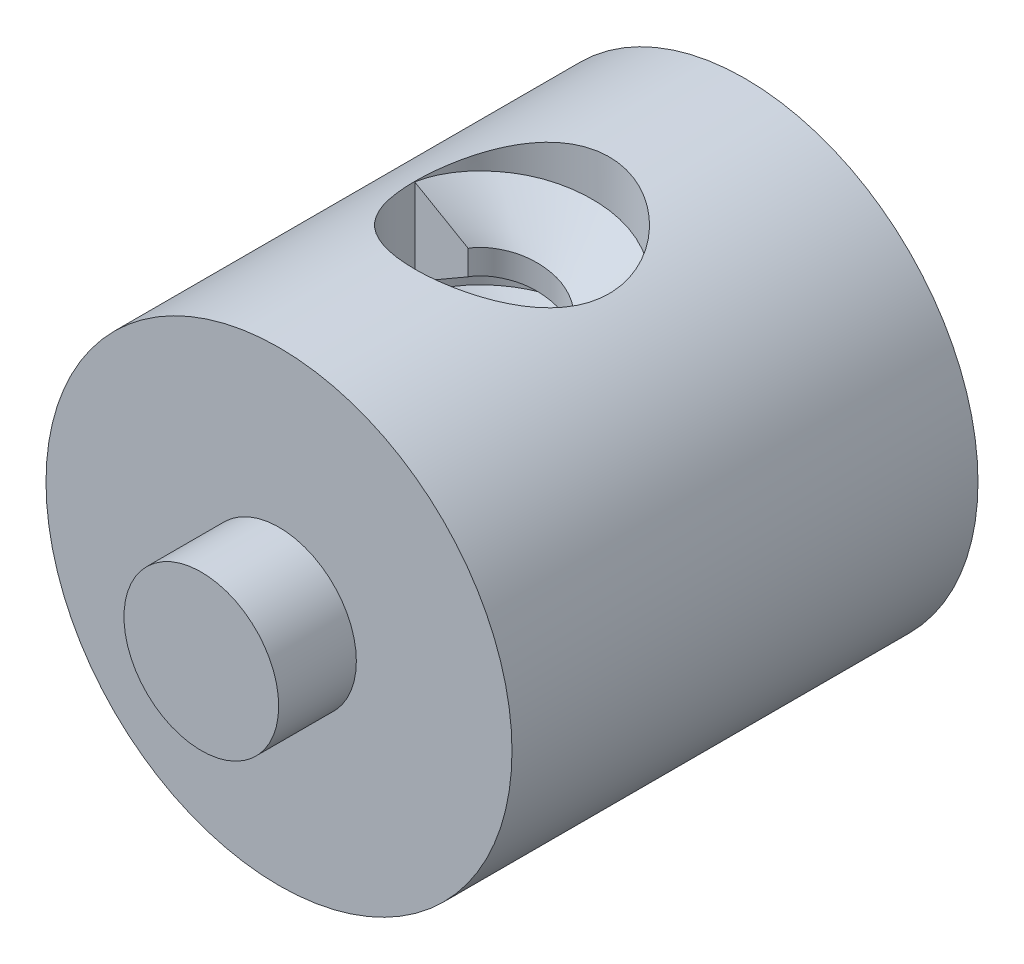
from build123d import *

# Parameters (mm, degrees)
SKETCH2_R               = 3.75
BOSS_EXTRUDE1_DEPTH     = 3.75
SKETCH3_R               = 1.245
BOSS_EXTRUDE3_DEPTH     = 1.25
CUT_EXTRUDE2_DEPTH      = 8.288689869
CUT_EXTRUDE2_DEPTH_BACK = 8.288689869
SKETCH4_R               = 1.565
THREAD2_PITCH           = 1.5875


with BuildPart() as part:
    # Sketch2 → Boss-Extrude1 (new, symmetric)
    with BuildSketch(Plane.XY):
        Circle(SKETCH2_R)
    extrude(amount=BOSS_EXTRUDE1_DEPTH, both=True)

    # Sketch3 → Boss-Extrude3 (add)
    with BuildSketch(Plane.XY.offset(3.75)):
        Circle(SKETCH3_R)
    boss_extrude3 = extrude(amount=BOSS_EXTRUDE3_DEPTH)

    # Mirror1: Boss-Extrude3 across plane
    add(boss_extrude3.mirror(Plane.XY))

    # Sketch4 → Cut-Extrude2 (cut, two sides: drawn at the far end of the back side and taken through both)
    with BuildSketch(Plane(origin=(0, 0, 0), x_dir=(1, 0, 0), z_dir=(0, 1, 0)).offset(-CUT_EXTRUDE2_DEPTH_BACK)):
        with Locations(Location((0, 0, 0), (0, 0, 270))):
            Circle(SKETCH4_R)
    extrude(amount=CUT_EXTRUDE2_DEPTH + CUT_EXTRUDE2_DEPTH_BACK, mode=Mode.SUBTRACT)

    # Thread2: the profile of Thread Profile3 profile screwed along a right-hand helix of 3.401575 turns, 8 arcs to a turn; built about Z, then put on its axis
    thread2_z = Axis((0, 0, 0), (0, 0, 1))
    thread2_corners = [(1.5653, 0, -0.000173205), (1.5653, 0, 1.389235701), (0.705740423, 0, 0.892968748), (0.705740423, 0, 0.496093748)]
    with BuildLine(mode=Mode.PRIVATE) as thread2_profile:
        Line(thread2_corners[0], thread2_corners[1])
        Line(thread2_corners[1], thread2_corners[2])
        Line(thread2_corners[2], thread2_corners[3])
        Line(thread2_corners[3], thread2_corners[0])
    thread2_cap = Face(thread2_profile.wire())
    thread2_turn_angles = [0, 22.5, 45, 67.5, 90, 112.5, 135, 157.5, 180, 202.5, 225, 247.5, 270, 292.5, 315, 337.5, 360]
    thread2_turn_weights = [1, 0.9238795325112867, 1, 0.9238795325112867, 1, 0.9238795325112867, 1, 0.9238795325112867, 1, 0.9238795325112867, 1, 0.9238795325112867, 1, 0.9238795325112867, 1, 0.9238795325112867, 1]
    thread2_turn_rails = [Edge.make_bspline([Vector(p[0], p[1], 0).rotate(thread2_z, thread2_turn_angles[k]) / thread2_turn_weights[k] + Vector(0, 0, p[2] + THREAD2_PITCH * thread2_turn_angles[k] / 360) for k in range(17)], [0, 0, 0, 1, 1, 2, 2, 3, 3, 4, 4, 5, 5, 6, 6, 7, 7, 8, 8, 8], 2, thread2_turn_weights) for p in thread2_corners]
    thread2_turn_sides = [Face.make_surface_from_curves(thread2_turn_rails[p[0]], thread2_turn_rails[p[1]]) for p in [(0, 1), (1, 2), (2, 3), (3, 0)]]
    thread2_last_angles = [1080, 1102.5, 1125, 1147.5, 1170, 1192.5, 1215, 1219.783464567, 1224.566929134]
    thread2_last_weights = [1, 0.9238795325112867, 1, 0.9238795325112867, 1, 0.9238795325112867, 1, 0.9965169669882292, 1]
    thread2_last_rails = [Edge.make_bspline([Vector(p[0], p[1], 0).rotate(thread2_z, thread2_last_angles[k]) / thread2_last_weights[k] + Vector(0, 0, p[2] + THREAD2_PITCH * thread2_last_angles[k] / 360) for k in range(9)], [0, 0, 0, 1, 1, 2, 2, 3, 3, 4, 4, 4], 2, thread2_last_weights) for p in thread2_corners]
    thread2_last_sides = [Face.make_surface_from_curves(thread2_last_rails[p[0]], thread2_last_rails[p[1]]) for p in [(0, 1), (1, 2), (2, 3), (3, 0)]]
    thread2 = Plane(origin=(0, 3.4, 0), x_dir=(-1, 0, 0), z_dir=(0, -1, 0)) * Solid(Shell([*[p.moved(Location((0, 0, THREAD2_PITCH * i))) for i in range(3) for p in thread2_turn_sides], *thread2_last_sides, thread2_cap, thread2_cap.rotate(thread2_z, 1224.566929134).moved(Location((0, 0, THREAD2_PITCH * 1224.566929134 / 360)))]))
    add(thread2)


solid = part.part
